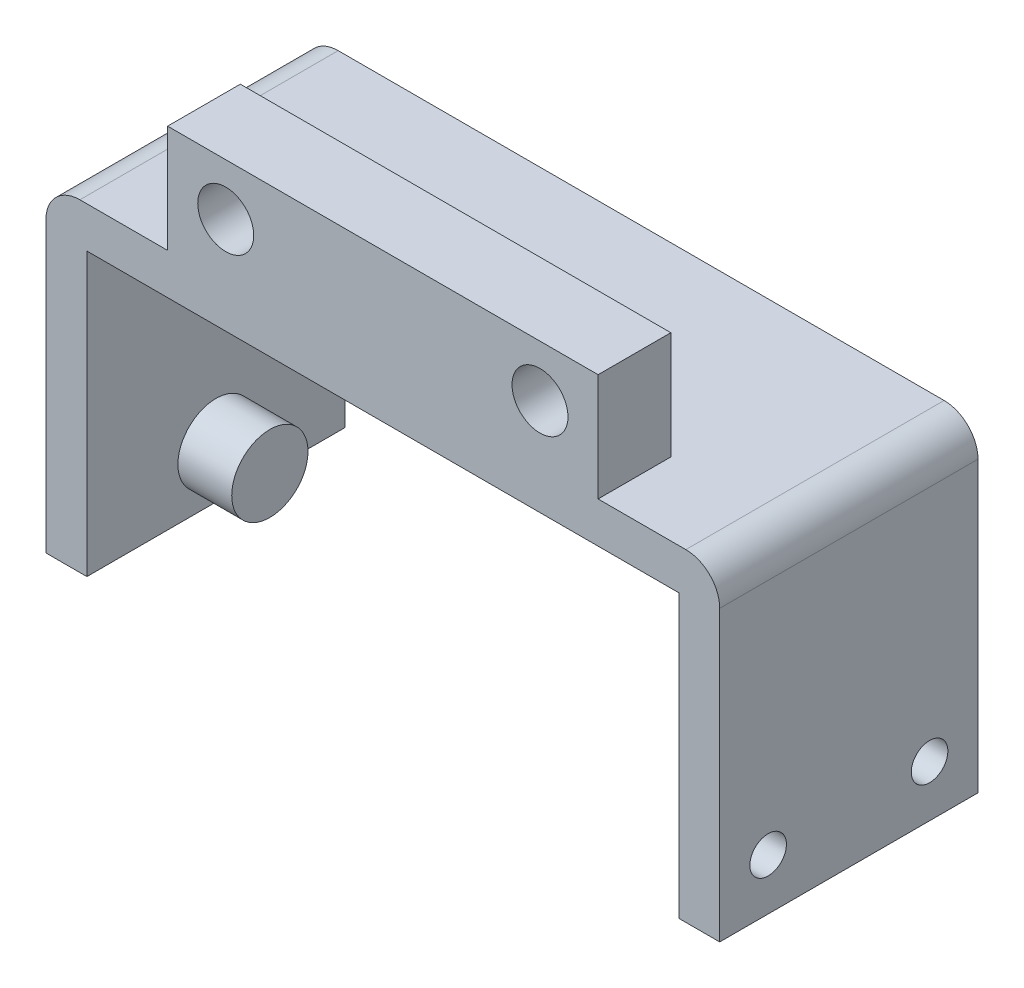
from build123d import *

# Parameters (mm, degrees)
SKETCH2_W           = 30.48
SKETCH2_H           = 38.1
SKETCH2_R           = 2.159
BOSS_EXTRUDE1_DEPTH = 4.826
SKETCH3_W           = 30.48
SKETCH3_H           = 4.826
BOSS_EXTRUDE2_DEPTH = 74.676
SKETCH4_W           = 4.826
SKETCH4_H           = 30.48
BOSS_EXTRUDE4_DEPTH = 33.274
SKETCH5_W           = 50.8
SKETCH5_H           = 8.581881715
BOSS_EXTRUDE5_DEPTH = 12.7
SKETCH6_R           = 3.302
CUT_EXTRUDE1_DEPTH  = 93.93369981
FILLET2_R           = 4
SKETCH7_R           = 4.5
BOSS_EXTRUDE6_DEPTH = 6.35


with BuildPart() as part:
    # Sketch2 → Boss-Extrude1 (new body)
    with BuildSketch(Plane(origin=(0, 0, 0), x_dir=(0, 0, -1), z_dir=(1, 0, 0))):
        with Locations((15.24, 19.05)):
            Rectangle(SKETCH2_W, SKETCH2_H)
        with Locations((5.715, 6.05)):
            Circle(SKETCH2_R, mode=Mode.SUBTRACT)
        with Locations((24.765, 6.05)):
            Circle(SKETCH2_R, mode=Mode.SUBTRACT)
    extrude(amount=BOSS_EXTRUDE1_DEPTH)

    # Sketch3 → Boss-Extrude2 (add)
    with BuildSketch(Plane.ZY):
        with Locations((-15.24, 35.687)):
            Rectangle(SKETCH3_W, SKETCH3_H)
    extrude(amount=BOSS_EXTRUDE2_DEPTH)

    # Sketch4 → Boss-Extrude4 (add)
    with BuildSketch(Plane.XZ.offset(-33.274)):
        with Locations((-72.263, -15.24)):
            Rectangle(SKETCH4_W, SKETCH4_H)
    extrude(amount=BOSS_EXTRUDE4_DEPTH)

    # Sketch5 → Boss-Extrude5 (add)
    with BuildSketch(Plane(origin=(0, 38.1, 0), x_dir=(1, 0, 0), z_dir=(0, 1, 0))):
        with Locations((-34.925, 4.290940857)):
            Rectangle(SKETCH5_W, SKETCH5_H)
    extrude(amount=BOSS_EXTRUDE5_DEPTH)

    # Sketch6 → Cut-Extrude1 (cut, through all)
    with BuildSketch(Plane(origin=(0, 0, -8.581881715), x_dir=(-1, 0, 0), z_dir=(0, 0, -1))):
        with Locations((53.467, 44.704)):
            Circle(SKETCH6_R)
        with Locations((16.383, 44.704)):
            Circle(SKETCH6_R)
    extrude(amount=-CUT_EXTRUDE1_DEPTH, mode=Mode.SUBTRACT)

    # Fillet2
    fillet2_edges = [part.edges().sort_by_distance(p)[0] for p in [
        (-74.676, 38.1, -15.24),
        (4.826, 38.1, -15.24),
    ]]
    fillet(fillet2_edges, radius=FILLET2_R)

    # Sketch7 → Boss-Extrude6 (add)
    with BuildSketch(Plane(origin=(-69.85, 0, 0), x_dir=(0, 0, -1), z_dir=(1, 0, 0))):
        with Locations((15.24, 6.096)):
            Circle(SKETCH7_R)
    extrude(amount=BOSS_EXTRUDE6_DEPTH)


solid = part.part
